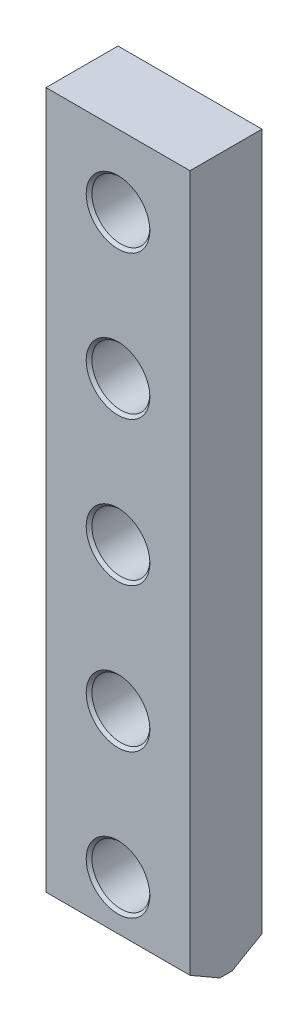
from build123d import *

# Parameters (mm, degrees)
SKETCH_1_W          = 50
SKETCH_1_H          = 248
EXTRUDE_1_DEPTH     = 25
SKETCH_2_R          = 10.05
CUT_EXTRUDE_1_DEPTH = 255.222343629
CHAMFER_1_SIZE      = 6
CHAMFER_1_SIZE2     = 10.392304845
CHAMFER_2_SIZE      = 6
CHAMFER_2_SIZE2     = 10.392304845
CHAMFER_3_SIZE      = 1


with BuildPart() as part:
    # Эскиз1 → Бобышка-Вытянуть1 (new body)
    with BuildSketch(Plane.XY):
        with Locations((25, 124)):
            Rectangle(SKETCH_1_W, SKETCH_1_H)
    extrude(amount=EXTRUDE_1_DEPTH)

    # Эскиз2 → Вырез-Вытянуть1 (cut, through all)
    with BuildSketch(Plane.XY.offset(25)):
        with Locations((25, 23)):
            Circle(SKETCH_2_R)
        with Locations((25, 73)):
            Circle(SKETCH_2_R)
        with Locations((25, 123)):
            Circle(SKETCH_2_R)
        with Locations((25, 173)):
            Circle(SKETCH_2_R)
        with Locations((25, 223)):
            Circle(SKETCH_2_R)
    extrude(amount=-CUT_EXTRUDE_1_DEPTH, mode=Mode.SUBTRACT)

    # Фаска1
    chamfer_1_edges = [part.edges().sort_by_distance(p)[0] for p in [
        (25, 0, 0),
    ]]
    chamfer_1_side = [part.faces().sort_by_distance(p)[0] for p in [
        (25, 2.529901184, 0),
    ]]
    chamfer(chamfer_1_edges, length=CHAMFER_1_SIZE, length2=CHAMFER_1_SIZE2, reference=chamfer_1_side[0])

    # Фаска2
    chamfer_2_edges = [part.edges().sort_by_distance(p)[0] for p in [
        (25, 0, 25),
    ]]
    chamfer_2_side = [part.faces().sort_by_distance(p)[0] for p in [
        (25, 2.529901184, 25),
    ]]
    chamfer(chamfer_2_edges, length=CHAMFER_2_SIZE, length2=CHAMFER_2_SIZE2, reference=chamfer_2_side[0])

    # Фаска3
    chamfer_3_edges = [part.edges().sort_by_distance(p)[0] for p in [
        (14.95, 223, 0),
        (14.95, 23, 0),
        (14.95, 73, 0),
        (14.95, 123, 0),
        (14.95, 173, 0),
        (14.95, 23, 25),
        (14.95, 73, 25),
        (14.95, 223, 25),
        (14.95, 173, 25),
        (14.95, 123, 25),
    ]]
    chamfer(chamfer_3_edges, length=CHAMFER_3_SIZE)


solid = part.part
